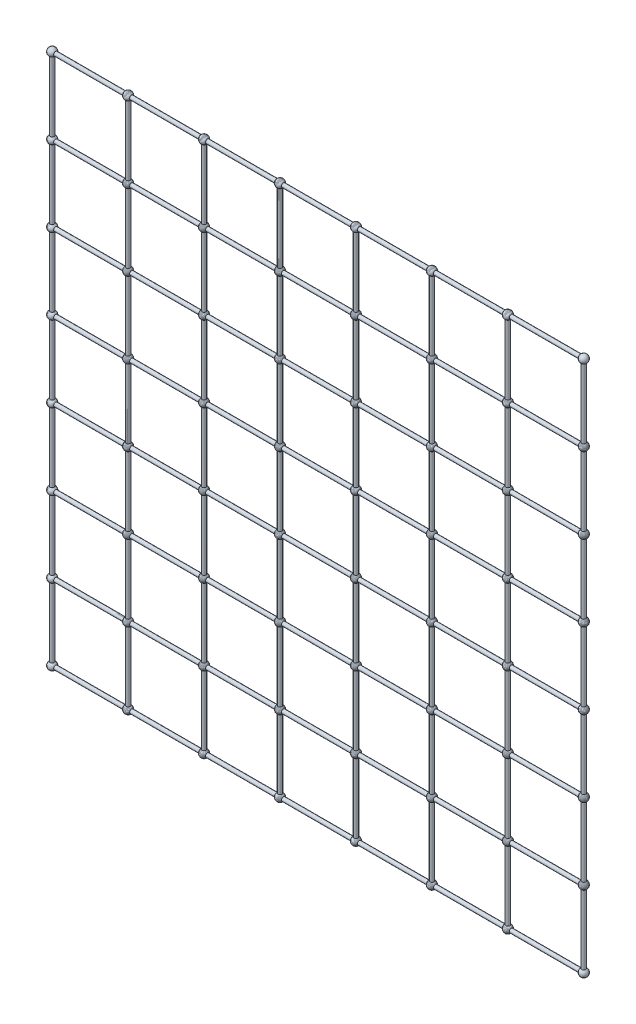
from build123d import *

# Parameters (mm, degrees)
SKETCH3_R           = 0.5
BOSS_EXTRUDE1_DEPTH = 19.05
CIRPATTERN1_COUNT   = 2
CIRPATTERN1_ANGLE   = 90
LPATTERN4_COUNT     = 2
LPATTERN4_PITCH     = 19.05
LPATTERN5_START     = 0.866025304
LPATTERN5_OUTLINE_R = 0.5
LPATTERN5_DEPTH     = 17.317949392
LPATTERN3_COUNT     = 7
LPATTERN3_PITCH     = 19.05
LPATTERN3_2_COUNT   = 7
LPATTERN3_2_PITCH   = 19.05


# Read off the part's stored shape, not the designer's step: LPattern5
with BuildPart() as part:
    # Sketch3 → Boss-Extrude1 (new body)
    with BuildSketch(Plane(origin=(0, 0, 0), x_dir=(1, 0, 0), z_dir=(0, 1, 0))):
        with Locations(Location((0, 0, 0), (0, 0, 270))):
            Circle(SKETCH3_R)
    boss_extrude1 = extrude(amount=BOSS_EXTRUDE1_DEPTH)

    # Sketch4 → Revolve25 (revolve)
    with BuildSketch(Plane(origin=(0, 19.05, 0), x_dir=(1, 0, 0), z_dir=(0, 1, 0))):
        with BuildLine():
            Line((0, 1), (0, -1))
            ThreePointArc((0, -1), (1, 0), (0, 1))
        make_face()
    revolve25 = revolve(axis=Axis((0, 19.05, -1), (0, 0, 1)))

    # Sketch5 → Revolve26 (revolve)
    with BuildSketch(Plane.XZ):
        with BuildLine():
            Line((0, -1), (0, 1))
            ThreePointArc((0, 1), (1, 0), (0, -1))
        make_face()
    revolve26 = revolve(axis=Axis((0, 0, -1), (0, 0, 1)))

    # CirPattern1: Boss-Extrude1, Revolve25, Revolve26 ×2 about axis
    cirpattern1_axis = Axis((0, 0, 10.012282745), (0, 0, -1))
    add([boss_extrude1.rotate(cirpattern1_axis, i * CIRPATTERN1_ANGLE / (CIRPATTERN1_COUNT - 1)) for i in range(1, CIRPATTERN1_COUNT)])
    add([revolve25.rotate(cirpattern1_axis, i * CIRPATTERN1_ANGLE / (CIRPATTERN1_COUNT - 1)) for i in range(1, CIRPATTERN1_COUNT)])
    add([revolve26.rotate(cirpattern1_axis, i * CIRPATTERN1_ANGLE / (CIRPATTERN1_COUNT - 1)) for i in range(1, CIRPATTERN1_COUNT)])

    # LPattern4: Boss-Extrude1, Revolve25 ×2
    with Locations(*[(i * LPATTERN4_PITCH, 0, 0) for i in range(1, LPATTERN4_COUNT)]):
        add(boss_extrude1)
        add(revolve25)

    # LPattern5 outline → LPattern5 (add)
    with BuildSketch(Plane.YZ.offset(LPATTERN5_START)):
        with Locations((19.05, 0)):
            Circle(LPATTERN5_OUTLINE_R)
    extrude(amount=LPATTERN5_DEPTH)


with BuildPart() as lpattern3_1:
    # LPattern3: pattern copy
    add(part.part.moved(Location(Vector(0, 1, 0) * (1 * LPATTERN3_PITCH))))


with BuildPart() as lpattern3_2:
    # LPattern3: pattern copy
    add(part.part.moved(Location(Vector(0, 1, 0) * (2 * LPATTERN3_PITCH))))


with BuildPart() as lpattern3_3:
    # LPattern3: pattern copy
    add(part.part.moved(Location(Vector(0, 1, 0) * (3 * LPATTERN3_PITCH))))


with BuildPart() as lpattern3_4:
    # LPattern3: pattern copy
    add(part.part.moved(Location(Vector(0, 1, 0) * (4 * LPATTERN3_PITCH))))


with BuildPart() as lpattern3_5:
    # LPattern3: pattern copy
    add(part.part.moved(Location(Vector(0, 1, 0) * (5 * LPATTERN3_PITCH))))


with BuildPart() as lpattern3_6:
    # LPattern3: pattern copy
    add(part.part.moved(Location(Vector(0, 1, 0) * (6 * LPATTERN3_PITCH))))


with BuildPart() as lpattern3_2_1:
    # LPattern3 2: pattern copy
    add(part.part.moved(Location(Vector(1, 0, 0) * (1 * LPATTERN3_2_PITCH))))


with BuildPart() as lpattern3_2_2:
    # LPattern3 2: pattern copy
    add(part.part.moved(Location(Vector(1, 0, 0) * (2 * LPATTERN3_2_PITCH))))


with BuildPart() as lpattern3_2_3:
    # LPattern3 2: pattern copy
    add(part.part.moved(Location(Vector(1, 0, 0) * (3 * LPATTERN3_2_PITCH))))


with BuildPart() as lpattern3_2_4:
    # LPattern3 2: pattern copy
    add(part.part.moved(Location(Vector(1, 0, 0) * (4 * LPATTERN3_2_PITCH))))


with BuildPart() as lpattern3_2_5:
    # LPattern3 2: pattern copy
    add(part.part.moved(Location(Vector(1, 0, 0) * (5 * LPATTERN3_2_PITCH))))


with BuildPart() as lpattern3_2_6:
    # LPattern3 2: pattern copy
    add(part.part.moved(Location(Vector(1, 0, 0) * (6 * LPATTERN3_2_PITCH))))


with BuildPart() as lpattern3_2_7:
    # LPattern3 2: pattern copy
    add(lpattern3_1.part.moved(Location(Vector(1, 0, 0) * (1 * LPATTERN3_2_PITCH))))


with BuildPart() as lpattern3_2_8:
    # LPattern3 2: pattern copy
    add(lpattern3_1.part.moved(Location(Vector(1, 0, 0) * (2 * LPATTERN3_2_PITCH))))


with BuildPart() as lpattern3_2_9:
    # LPattern3 2: pattern copy
    add(lpattern3_1.part.moved(Location(Vector(1, 0, 0) * (3 * LPATTERN3_2_PITCH))))


with BuildPart() as lpattern3_2_10:
    # LPattern3 2: pattern copy
    add(lpattern3_1.part.moved(Location(Vector(1, 0, 0) * (4 * LPATTERN3_2_PITCH))))


with BuildPart() as lpattern3_2_11:
    # LPattern3 2: pattern copy
    add(lpattern3_1.part.moved(Location(Vector(1, 0, 0) * (5 * LPATTERN3_2_PITCH))))


with BuildPart() as lpattern3_2_12:
    # LPattern3 2: pattern copy
    add(lpattern3_1.part.moved(Location(Vector(1, 0, 0) * (6 * LPATTERN3_2_PITCH))))


with BuildPart() as lpattern3_2_13:
    # LPattern3 2: pattern copy
    add(lpattern3_2.part.moved(Location(Vector(1, 0, 0) * (1 * LPATTERN3_2_PITCH))))


with BuildPart() as lpattern3_2_14:
    # LPattern3 2: pattern copy
    add(lpattern3_2.part.moved(Location(Vector(1, 0, 0) * (2 * LPATTERN3_2_PITCH))))


with BuildPart() as lpattern3_2_15:
    # LPattern3 2: pattern copy
    add(lpattern3_2.part.moved(Location(Vector(1, 0, 0) * (3 * LPATTERN3_2_PITCH))))


with BuildPart() as lpattern3_2_16:
    # LPattern3 2: pattern copy
    add(lpattern3_2.part.moved(Location(Vector(1, 0, 0) * (4 * LPATTERN3_2_PITCH))))


with BuildPart() as lpattern3_2_17:
    # LPattern3 2: pattern copy
    add(lpattern3_2.part.moved(Location(Vector(1, 0, 0) * (5 * LPATTERN3_2_PITCH))))


with BuildPart() as lpattern3_2_18:
    # LPattern3 2: pattern copy
    add(lpattern3_2.part.moved(Location(Vector(1, 0, 0) * (6 * LPATTERN3_2_PITCH))))


with BuildPart() as lpattern3_2_19:
    # LPattern3 2: pattern copy
    add(lpattern3_3.part.moved(Location(Vector(1, 0, 0) * (1 * LPATTERN3_2_PITCH))))


with BuildPart() as lpattern3_2_20:
    # LPattern3 2: pattern copy
    add(lpattern3_3.part.moved(Location(Vector(1, 0, 0) * (2 * LPATTERN3_2_PITCH))))


with BuildPart() as lpattern3_2_21:
    # LPattern3 2: pattern copy
    add(lpattern3_3.part.moved(Location(Vector(1, 0, 0) * (3 * LPATTERN3_2_PITCH))))


with BuildPart() as lpattern3_2_22:
    # LPattern3 2: pattern copy
    add(lpattern3_3.part.moved(Location(Vector(1, 0, 0) * (4 * LPATTERN3_2_PITCH))))


with BuildPart() as lpattern3_2_23:
    # LPattern3 2: pattern copy
    add(lpattern3_3.part.moved(Location(Vector(1, 0, 0) * (5 * LPATTERN3_2_PITCH))))


with BuildPart() as lpattern3_2_24:
    # LPattern3 2: pattern copy
    add(lpattern3_3.part.moved(Location(Vector(1, 0, 0) * (6 * LPATTERN3_2_PITCH))))


with BuildPart() as lpattern3_2_25:
    # LPattern3 2: pattern copy
    add(lpattern3_4.part.moved(Location(Vector(1, 0, 0) * (1 * LPATTERN3_2_PITCH))))


with BuildPart() as lpattern3_2_26:
    # LPattern3 2: pattern copy
    add(lpattern3_4.part.moved(Location(Vector(1, 0, 0) * (2 * LPATTERN3_2_PITCH))))


with BuildPart() as lpattern3_2_27:
    # LPattern3 2: pattern copy
    add(lpattern3_4.part.moved(Location(Vector(1, 0, 0) * (3 * LPATTERN3_2_PITCH))))


with BuildPart() as lpattern3_2_28:
    # LPattern3 2: pattern copy
    add(lpattern3_4.part.moved(Location(Vector(1, 0, 0) * (4 * LPATTERN3_2_PITCH))))


with BuildPart() as lpattern3_2_29:
    # LPattern3 2: pattern copy
    add(lpattern3_4.part.moved(Location(Vector(1, 0, 0) * (5 * LPATTERN3_2_PITCH))))


with BuildPart() as lpattern3_2_30:
    # LPattern3 2: pattern copy
    add(lpattern3_4.part.moved(Location(Vector(1, 0, 0) * (6 * LPATTERN3_2_PITCH))))


with BuildPart() as lpattern3_2_31:
    # LPattern3 2: pattern copy
    add(lpattern3_5.part.moved(Location(Vector(1, 0, 0) * (1 * LPATTERN3_2_PITCH))))


with BuildPart() as lpattern3_2_32:
    # LPattern3 2: pattern copy
    add(lpattern3_5.part.moved(Location(Vector(1, 0, 0) * (2 * LPATTERN3_2_PITCH))))


with BuildPart() as lpattern3_2_33:
    # LPattern3 2: pattern copy
    add(lpattern3_5.part.moved(Location(Vector(1, 0, 0) * (3 * LPATTERN3_2_PITCH))))


with BuildPart() as lpattern3_2_34:
    # LPattern3 2: pattern copy
    add(lpattern3_5.part.moved(Location(Vector(1, 0, 0) * (4 * LPATTERN3_2_PITCH))))


with BuildPart() as lpattern3_2_35:
    # LPattern3 2: pattern copy
    add(lpattern3_5.part.moved(Location(Vector(1, 0, 0) * (5 * LPATTERN3_2_PITCH))))


with BuildPart() as lpattern3_2_36:
    # LPattern3 2: pattern copy
    add(lpattern3_5.part.moved(Location(Vector(1, 0, 0) * (6 * LPATTERN3_2_PITCH))))


with BuildPart() as lpattern3_2_37:
    # LPattern3 2: pattern copy
    add(lpattern3_6.part.moved(Location(Vector(1, 0, 0) * (1 * LPATTERN3_2_PITCH))))


with BuildPart() as lpattern3_2_38:
    # LPattern3 2: pattern copy
    add(lpattern3_6.part.moved(Location(Vector(1, 0, 0) * (2 * LPATTERN3_2_PITCH))))


with BuildPart() as lpattern3_2_39:
    # LPattern3 2: pattern copy
    add(lpattern3_6.part.moved(Location(Vector(1, 0, 0) * (3 * LPATTERN3_2_PITCH))))


with BuildPart() as lpattern3_2_40:
    # LPattern3 2: pattern copy
    add(lpattern3_6.part.moved(Location(Vector(1, 0, 0) * (4 * LPATTERN3_2_PITCH))))


with BuildPart() as lpattern3_2_41:
    # LPattern3 2: pattern copy
    add(lpattern3_6.part.moved(Location(Vector(1, 0, 0) * (5 * LPATTERN3_2_PITCH))))


with BuildPart() as lpattern3_2_42:
    # LPattern3 2: pattern copy
    add(lpattern3_6.part.moved(Location(Vector(1, 0, 0) * (6 * LPATTERN3_2_PITCH))))


solid = Compound([part.part, lpattern3_1.part, lpattern3_2.part, lpattern3_3.part, lpattern3_4.part, lpattern3_5.part, lpattern3_6.part, lpattern3_2_1.part, lpattern3_2_2.part, lpattern3_2_3.part, lpattern3_2_4.part, lpattern3_2_5.part, lpattern3_2_6.part, lpattern3_2_7.part, lpattern3_2_8.part, lpattern3_2_9.part, lpattern3_2_10.part, lpattern3_2_11.part, lpattern3_2_12.part, lpattern3_2_13.part, lpattern3_2_14.part, lpattern3_2_15.part, lpattern3_2_16.part, lpattern3_2_17.part, lpattern3_2_18.part, lpattern3_2_19.part, lpattern3_2_20.part, lpattern3_2_21.part, lpattern3_2_22.part, lpattern3_2_23.part, lpattern3_2_24.part, lpattern3_2_25.part, lpattern3_2_26.part, lpattern3_2_27.part, lpattern3_2_28.part, lpattern3_2_29.part, lpattern3_2_30.part, lpattern3_2_31.part, lpattern3_2_32.part, lpattern3_2_33.part, lpattern3_2_34.part, lpattern3_2_35.part, lpattern3_2_36.part, lpattern3_2_37.part, lpattern3_2_38.part, lpattern3_2_39.part, lpattern3_2_40.part, lpattern3_2_41.part, lpattern3_2_42.part])
